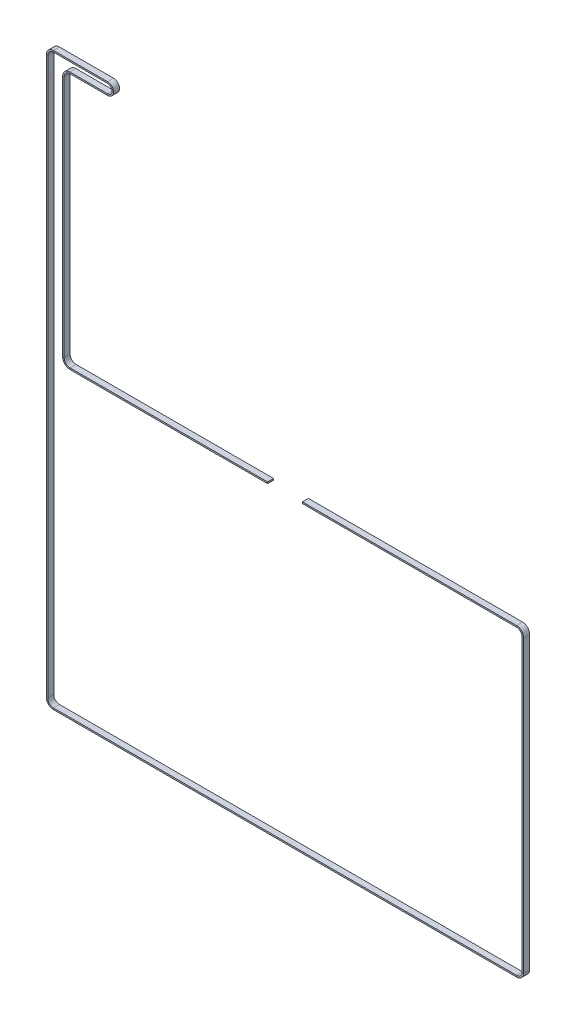
from build123d import *

# Parameters (mm, degrees)
SKETCH2_W = 6
SKETCH2_H = 1.5


with BuildPart() as part:
    # Sweep1: sweep along a path in Sketch1
    with BuildLine(Plane(origin=(0, -21, 4.45), x_dir=(1, 0, 0), z_dir=(0, 0, 1))) as sweep1_path:
        Line((241.850000015, -192.15), (455.500000015, -192.15))
        ThreePointArc((455.500000015, -192.15), (460.007805745, -194.01719427), (461.875000015, -198.525))
        Line((461.875000015, -198.525), (461.875, -488))
        ThreePointArc((461.875, -488), (460.00780573, -492.50780573), (455.5, -494.375))
        Line((455.5, -494.375), (-6.5, -494.375))
        ThreePointArc((-6.5, -494.375), (-11.00780573, -492.50780573), (-12.875, -488))
        Line((-12.875, -488), (-12.875, 67.325))
        ThreePointArc((-12.875, 67.325), (-11.00780573, 71.83280573), (-6.5, 73.7))
        Line((-6.5, 73.7), (47.5, 73.7))
        ThreePointArc((47.5, 73.7), (52.7, 68.5), (47.5, 63.3))
        Line((47.5, 63.3), (10, 63.3))
        ThreePointArc((10, 63.3), (5.333095244, 61.366904756), (3.4, 56.7))
        Line((3.4, 56.7), (3.4, -185.7))
        ThreePointArc((3.4, -185.7), (5.333095248, -190.366904766), (10.000000015, -192.300000014))
        Line((10.000000015, -192.300000014), (207.150000015, -192.300000014))
    # Sketch2 → Sweep1 (sweep)
    with BuildSketch(Plane(origin=(241.850000015, -213.15, 4.45), x_dir=(0, 0, 1), z_dir=(-1, 0, 0))):
        Rectangle(SKETCH2_W, SKETCH2_H)
    sweep(path=sweep1_path.line)


solid = part.part
